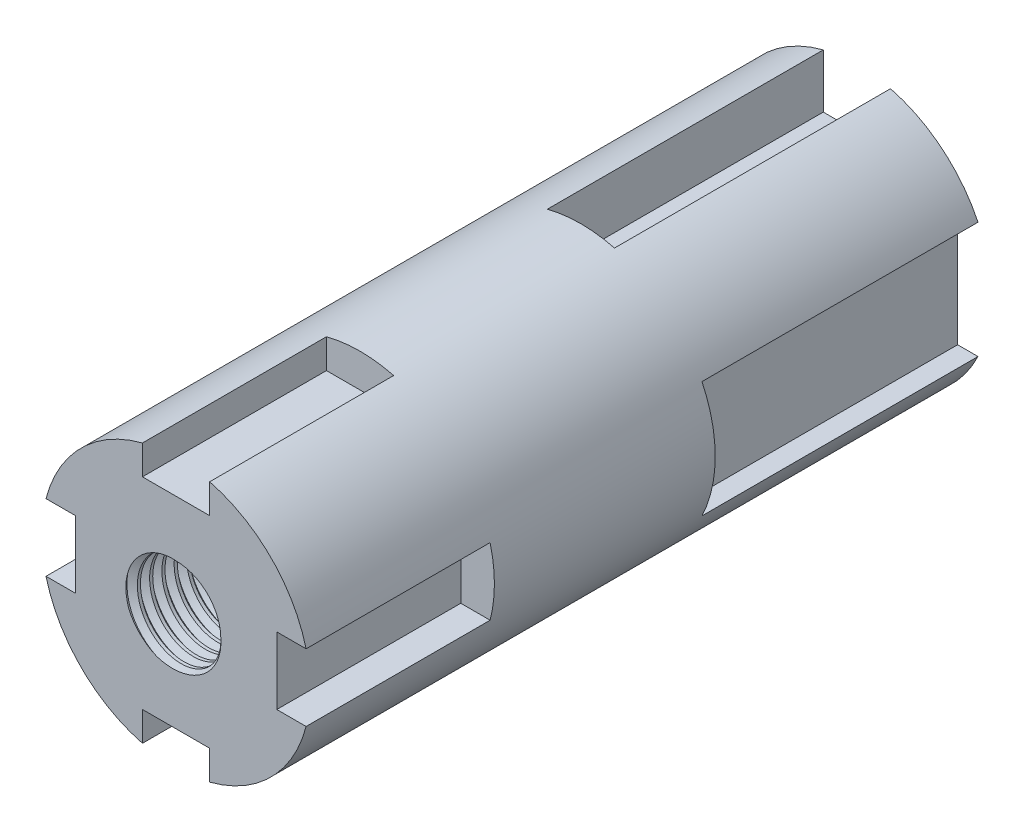
from build123d import *

# Parameters (mm, degrees)
SKETCH3_R           = 5.475
BOSS_EXTRUDE2_DEPTH = 27.75
SKETCH6_W           = 1.37
SKETCH6_H           = 2.74
SKETCH6_W_2         = 2.74
SKETCH6_H_2         = 1.37
CUT_EXTRUDE1_DEPTH  = 7.5
SKETCH4_W           = 2.74
SKETCH4_H           = 2.37
SKETCH4_W_2         = 1.37
SKETCH4_H_2         = 4.74
CUT_EXTRUDE2_DEPTH  = 11.25
SKETCH7_R           = 1.825
CUT_EXTRUDE3_DEPTH  = 5
CUT_EXTRUDE4_START  = -5
SKETCH8_R           = 1.825
CUT_EXTRUDE4_DEPTH  = 5
THREAD1_PITCH       = 0.5
THREAD2_PITCH       = 0.5


with BuildPart() as part:
    # Sketch3 → Boss-Extrude2 (new body)
    with BuildSketch(Plane.XY):
        Circle(SKETCH3_R)
    extrude(amount=BOSS_EXTRUDE2_DEPTH)

    # Sketch6 → Cut-Extrude1 (cut)
    with BuildSketch(Plane.XY.offset(27.75)):
        with Locations((4.79, 0)):
            Rectangle(SKETCH6_W, SKETCH6_H)
        with Locations((0, 4.79)):
            Rectangle(SKETCH6_W_2, SKETCH6_H_2)
        with Locations((0, -4.79)):
            Rectangle(SKETCH6_W_2, SKETCH6_H_2)
        with Locations((-4.79, 0)):
            Rectangle(SKETCH6_W, SKETCH6_H)
    extrude(amount=-CUT_EXTRUDE1_DEPTH, mode=Mode.SUBTRACT)

    # Sketch4 → Cut-Extrude2 (cut)
    with BuildSketch(Plane(origin=(0, 0, 0), x_dir=(-1, 0, 0), z_dir=(0, 0, -1))):
        with Locations((0, 4.29)):
            Rectangle(SKETCH4_W, SKETCH4_H)
        with Locations((-4.79, 0)):
            Rectangle(SKETCH4_W_2, SKETCH4_H_2)
        with Locations((4.79, 0)):
            Rectangle(SKETCH4_W_2, SKETCH4_H_2)
    extrude(amount=-CUT_EXTRUDE2_DEPTH, mode=Mode.SUBTRACT)

    # Sketch7 → Cut-Extrude3 (cut)
    with BuildSketch(Plane(origin=(0, 0, 0), x_dir=(-1, 0, 0), z_dir=(0, 0, -1))):
        Circle(SKETCH7_R)
    extrude(amount=-CUT_EXTRUDE3_DEPTH, mode=Mode.SUBTRACT)

    # Sketch8 → Cut-Extrude4 (cut)
    with BuildSketch(Plane.XY.offset(27.75).offset(CUT_EXTRUDE4_START)):
        with Locations(Location((0, 0, 0), (0, 0, 180))):
            Circle(SKETCH8_R)
    extrude(amount=CUT_EXTRUDE4_DEPTH, mode=Mode.SUBTRACT)

    # Thread1: the profile of Thread Profile1 profile screwed along a right-hand helix of 20 turns, 6 arcs to a turn; built about Z, then put on its axis
    thread1_z = Axis((0, 0, 0), (0, 0, 1))
    thread1_corners = [(1.8247, 0, -0.000173205), (2.095632938, 0, 0.156249999), (2.095632938, 0, 0.218749999), (1.8247, 0, 0.375173204)]
    with BuildLine(mode=Mode.PRIVATE) as thread1_profile:
        Line(thread1_corners[0], thread1_corners[1])
        Line(thread1_corners[1], thread1_corners[2])
        Line(thread1_corners[2], thread1_corners[3])
        Line(thread1_corners[3], thread1_corners[0])
    thread1_cap = Face(thread1_profile.wire())
    thread1_turn_angles = [0, 30, 60, 90, 120, 150, 180, 210, 240, 270, 300, 330, 360]
    thread1_turn_weights = [1, 0.8660254037844387, 1, 0.8660254037844387, 1, 0.8660254037844387, 1, 0.8660254037844387, 1, 0.8660254037844387, 1, 0.8660254037844387, 1]
    thread1_turn_rails = [Edge.make_bspline([Vector(p[0], p[1], 0).rotate(thread1_z, thread1_turn_angles[k]) / thread1_turn_weights[k] + Vector(0, 0, p[2] + THREAD1_PITCH * thread1_turn_angles[k] / 360) for k in range(13)], [0, 0, 0, 1, 1, 2, 2, 3, 3, 4, 4, 5, 5, 6, 6, 6], 2, thread1_turn_weights) for p in thread1_corners]
    thread1_turn_sides = [Face.make_surface_from_curves(thread1_turn_rails[p[0]], thread1_turn_rails[p[1]]) for p in [(0, 1), (1, 2), (2, 3), (3, 0)]]
    thread1 = Plane(origin=(0, 0, 5), x_dir=(-1, 0, 0), z_dir=(0, 0, -1)) * Solid(Shell([*[p.moved(Location((0, 0, THREAD1_PITCH * i))) for i in range(20) for p in thread1_turn_sides], thread1_cap, thread1_cap.rotate(thread1_z, 7200).moved(Location((0, 0, THREAD1_PITCH * 7200 / 360)))]))
    add(thread1, mode=Mode.SUBTRACT)

    # Thread2: the profile of Thread Profile2 profile screwed along a right-hand helix of 20 turns, 6 arcs to a turn; built about Z, then put on its axis
    thread2_z = Axis((0, 0, 0), (0, 0, 1))
    thread2_corners = [(1.8247, 0, -0.000173205), (2.095632938, 0, 0.156249999), (2.095632938, 0, 0.218749999), (1.8247, 0, 0.375173204)]
    with BuildLine(mode=Mode.PRIVATE) as thread2_profile:
        Line(thread2_corners[0], thread2_corners[1])
        Line(thread2_corners[1], thread2_corners[2])
        Line(thread2_corners[2], thread2_corners[3])
        Line(thread2_corners[3], thread2_corners[0])
    thread2_cap = Face(thread2_profile.wire())
    thread2_turn_angles = [0, 30, 60, 90, 120, 150, 180, 210, 240, 270, 300, 330, 360]
    thread2_turn_weights = [1, 0.8660254037844387, 1, 0.8660254037844387, 1, 0.8660254037844387, 1, 0.8660254037844387, 1, 0.8660254037844387, 1, 0.8660254037844387, 1]
    thread2_turn_rails = [Edge.make_bspline([Vector(p[0], p[1], 0).rotate(thread2_z, thread2_turn_angles[k]) / thread2_turn_weights[k] + Vector(0, 0, p[2] + THREAD2_PITCH * thread2_turn_angles[k] / 360) for k in range(13)], [0, 0, 0, 1, 1, 2, 2, 3, 3, 4, 4, 5, 5, 6, 6, 6], 2, thread2_turn_weights) for p in thread2_corners]
    thread2_turn_sides = [Face.make_surface_from_curves(thread2_turn_rails[p[0]], thread2_turn_rails[p[1]]) for p in [(0, 1), (1, 2), (2, 3), (3, 0)]]
    thread2 = Plane(origin=(0, 0, 22.75), x_dir=(1, 0, 0), z_dir=(0, 0, 1)) * Solid(Shell([*[p.moved(Location((0, 0, THREAD2_PITCH * i))) for i in range(20) for p in thread2_turn_sides], thread2_cap, thread2_cap.rotate(thread2_z, 7200).moved(Location((0, 0, THREAD2_PITCH * 7200 / 360)))]))
    add(thread2, mode=Mode.SUBTRACT)


solid = part.part
